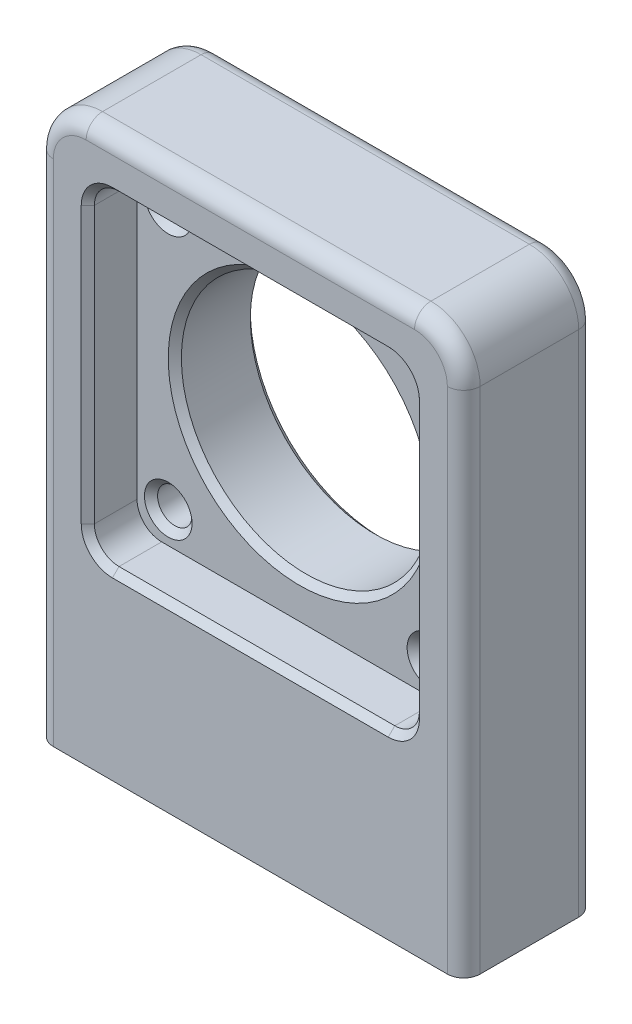
from build123d import *

# Parameters (mm, degrees)
SKETCH1_W           = 26
SKETCH1_H           = 34
BOSS_EXTRUDE1_DEPTH = 8
CUT_EXTRUDE1_REACH  = 24.847
SKETCH2_R           = 7.6
SKETCH2_R_2         = 1.05
SKETCH5_R           = 2.3
CUT_EXTRUDE7_DEPTH  = 4.5
SKETCH6_W           = 19.8
SKETCH6_H           = 19.8
CUT_EXTRUDE8_DEPTH  = 3
SKETCH7_R           = 1.9
CUT_EXTRUDE9_DEPTH  = 3
FILLET1_R           = 3
CHAMFER3_SIZE       = 0.4
FILLET2_R           = 1.5
CHAMFER7_SIZE       = 1
CHAMFER9_SIZE       = 0.4
CHAMFER10_SIZE      = 0.4
FILLET4_R           = 1


with BuildPart() as part:
    # Sketch1 → Boss-Extrude1 (new body)
    with BuildSketch(Plane.XY):
        Rectangle(SKETCH1_W, SKETCH1_H)
    extrude(amount=BOSS_EXTRUDE1_DEPTH)

    # Sketch2 → Cut-Extrude1 (cut, up to next)
    with BuildSketch(Plane.XY.offset(8), mode=Mode.PRIVATE) as cut_extrude1_sk1:
        with Locations((0, 4)):
            Circle(SKETCH2_R)
    cut_extrude1_tool1 = extrude(cut_extrude1_sk1.sketch, amount=-CUT_EXTRUDE1_REACH, mode=Mode.PRIVATE) & part.part
    # Sketch2 → Cut-Extrude1 (cut, up to next)
    with BuildSketch(Plane.XY.offset(8), mode=Mode.PRIVATE) as cut_extrude1_sk2:
        with Locations((-8, 12)):
            Circle(SKETCH2_R_2)
    cut_extrude1_tool2 = extrude(cut_extrude1_sk2.sketch, amount=-CUT_EXTRUDE1_REACH, mode=Mode.PRIVATE) & part.part
    # Sketch2 → Cut-Extrude1 (cut, up to next)
    with BuildSketch(Plane.XY.offset(8), mode=Mode.PRIVATE) as cut_extrude1_sk3:
        with Locations((8, 12)):
            Circle(SKETCH2_R_2)
    cut_extrude1_tool3 = extrude(cut_extrude1_sk3.sketch, amount=-CUT_EXTRUDE1_REACH, mode=Mode.PRIVATE) & part.part
    # Sketch2 → Cut-Extrude1 (cut, up to next)
    with BuildSketch(Plane.XY.offset(8), mode=Mode.PRIVATE) as cut_extrude1_sk4:
        with Locations((8, -4)):
            Circle(SKETCH2_R_2)
    cut_extrude1_tool4 = extrude(cut_extrude1_sk4.sketch, amount=-CUT_EXTRUDE1_REACH, mode=Mode.PRIVATE) & part.part
    # Sketch2 → Cut-Extrude1 (cut, up to next)
    with BuildSketch(Plane.XY.offset(8), mode=Mode.PRIVATE) as cut_extrude1_sk5:
        with Locations((-8, -4)):
            Circle(SKETCH2_R_2)
    cut_extrude1_tool5 = extrude(cut_extrude1_sk5.sketch, amount=-CUT_EXTRUDE1_REACH, mode=Mode.PRIVATE) & part.part
    add(cut_extrude1_tool1.solids().sort_by_distance((0, 4, 8))[0], mode=Mode.SUBTRACT)
    add(cut_extrude1_tool2.solids().sort_by_distance((-8, 12, 8))[0], mode=Mode.SUBTRACT)
    add(cut_extrude1_tool3.solids().sort_by_distance((8, 12, 8))[0], mode=Mode.SUBTRACT)
    add(cut_extrude1_tool4.solids().sort_by_distance((8, -4, 8))[0], mode=Mode.SUBTRACT)
    add(cut_extrude1_tool5.solids().sort_by_distance((-8, -4, 8))[0], mode=Mode.SUBTRACT)

    # Sketch5 → Cut-Extrude7 (cut)
    with BuildSketch(Plane.XZ.offset(17)):
        with Locations(Location((6, 4, 0), (0, 0, 270))):
            Circle(SKETCH5_R)
        with Locations(Location((-6, 4, 0), (0, 0, 90))):
            Circle(SKETCH5_R)
    extrude(amount=-CUT_EXTRUDE7_DEPTH, mode=Mode.SUBTRACT)

    # Sketch6 → Cut-Extrude8 (cut)
    with BuildSketch(Plane.XY.offset(8)):
        with Locations((0, 4)):
            Rectangle(SKETCH6_W, SKETCH6_H)
    extrude(amount=-CUT_EXTRUDE8_DEPTH, mode=Mode.SUBTRACT)

    # Sketch7 → Cut-Extrude9 (cut)
    with BuildSketch(Plane(origin=(0, 0, 0), x_dir=(-1, 0, 0), z_dir=(0, 0, -1))):
        with Locations((-8, 12)):
            Circle(SKETCH7_R)
        with Locations((8, 12)):
            Circle(SKETCH7_R)
        with Locations((-8, -4)):
            Circle(SKETCH7_R)
        with Locations((8, -4)):
            Circle(SKETCH7_R)
    extrude(amount=-CUT_EXTRUDE9_DEPTH, mode=Mode.SUBTRACT)

    # Fillet1
    fillet1_edges = [part.edges().sort_by_distance(p)[0] for p in [
        (-13, 17, 4),
        (13, 17, 4),
    ]]
    fillet(fillet1_edges, radius=FILLET1_R)

    # Chamfer3
    chamfer3_edges = [part.edges().sort_by_distance(p)[0] for p in [
        (6, -12.5, 6.3),
        (6, -17, 6.3),
        (-6, -12.5, 1.7),
        (-6, -17, 1.7),
    ]]
    chamfer(chamfer3_edges, length=CHAMFER3_SIZE)

    # Fillet2
    fillet2_edges = [part.edges().sort_by_distance(p)[0] for p in [
        (9.9, 13.9, 6.5),
        (9.9, -5.9, 6.5),
        (-9.9, -5.9, 6.5),
        (-9.9, 13.9, 6.5),
    ]]
    fillet(fillet2_edges, radius=FILLET2_R)

    # Chamfer7
    # the kernel refuses this chamfer: 1 mm, written as the material it adds along each edge
    with BuildSketch(Plane(origin=(-8, 12, 3), x_dir=(-1, 0, 0), z_dir=(0, -1, 0))) as chamfer7_piece_1_section:
        Polygon((1.9, CHAMFER7_SIZE), (1.9 - CHAMFER7_SIZE, 0), (1.9, 0), align=None)
    chamfer7_piece_1 = revolve(axis=Axis((-8, 12, 3), (0, 0, -1)), mode=Mode.PRIVATE)
    chamfer7_piece_1 = chamfer7_piece_1 - Plane(origin=(-8, 12, 2.4231984), x_dir=(1, 0, 0), z_dir=(0, 0, 1)) * Cylinder(1.05, 8, mode=Mode.PRIVATE)
    add(chamfer7_piece_1)
    with BuildSketch(Plane(origin=(8, 12, 3), x_dir=(-1, 0, 0), z_dir=(0, -1, 0))) as chamfer7_piece_2_section:
        Polygon((1.9, CHAMFER7_SIZE), (1.9 - CHAMFER7_SIZE, 0), (1.9, 0), align=None)
    chamfer7_piece_2 = revolve(axis=Axis((8, 12, 3), (0, 0, -1)), mode=Mode.PRIVATE)
    chamfer7_piece_2 = chamfer7_piece_2 - Plane(origin=(8, 12, 2.4231984), x_dir=(1, 0, 0), z_dir=(0, 0, 1)) * Cylinder(1.05, 8, mode=Mode.PRIVATE)
    add(chamfer7_piece_2)
    with BuildSketch(Plane(origin=(8, -4, 3), x_dir=(-1, 0, 0), z_dir=(0, -1, 0))) as chamfer7_piece_3_section:
        Polygon((1.9, CHAMFER7_SIZE), (1.9 - CHAMFER7_SIZE, 0), (1.9, 0), align=None)
    chamfer7_piece_3 = revolve(axis=Axis((8, -4, 3), (0, 0, -1)), mode=Mode.PRIVATE)
    chamfer7_piece_3 = chamfer7_piece_3 - Plane(origin=(8, -4, 2.4231984), x_dir=(1, 0, 0), z_dir=(0, 0, 1)) * Cylinder(1.05, 8, mode=Mode.PRIVATE)
    add(chamfer7_piece_3)
    with BuildSketch(Plane(origin=(-8, -4, 3), x_dir=(-1, 0, 0), z_dir=(0, -1, 0))) as chamfer7_piece_4_section:
        Polygon((1.9, CHAMFER7_SIZE), (1.9 - CHAMFER7_SIZE, 0), (1.9, 0), align=None)
    chamfer7_piece_4 = revolve(axis=Axis((-8, -4, 3), (0, 0, -1)), mode=Mode.PRIVATE)
    chamfer7_piece_4 = chamfer7_piece_4 - Plane(origin=(-8, -4, 2.4231984), x_dir=(1, 0, 0), z_dir=(0, 0, 1)) * Cylinder(1.05, 8, mode=Mode.PRIVATE)
    add(chamfer7_piece_4)

    # Chamfer9
    chamfer9_edges = [part.edges().sort_by_distance(p)[0] for p in [
        (0, -5.9, 8),
        (-9.9, 4, 8),
        (9.9, 4, 8),
        (0, 13.9, 8),
        (-9.460660172, -5.460660172, 8),
        (9.460660172, -5.460660172, 8),
        (9.460660172, 13.460660172, 8),
        (-9.460660172, 13.460660172, 8),
        (-7.6, 4, 0),
        (-7.6, 4, 5),
        (-6.1, 12, 0),
        (9.9, -4, 0),
        (-6.1, -4, 0),
        (9.9, 12, 0),
    ]]
    chamfer(chamfer9_edges, length=CHAMFER9_SIZE)

    # Chamfer10
    chamfer10_edges = [part.edges().sort_by_distance(p)[0] for p in [
        (-9.05, 12, 5),
        (6.95, 12, 5),
        (6.95, -4, 5),
        (-9.05, -4, 5),
    ]]
    chamfer(chamfer10_edges, length=CHAMFER10_SIZE)

    # Fillet4
    fillet4_edges = [part.edges().sort_by_distance(p)[0] for p in [
        (13, -1.5, 8),
        (13, -1.5, 0),
        (0, 17, 0),
        (0, 17, 8),
        (-13, -1.5, 0),
        (-12.121320344, 16.121320344, 0),
        (12.121320344, 16.121320344, 0),
        (-13, -1.5, 8),
        (-12.121320344, 16.121320344, 8),
        (12.121320344, 16.121320344, 8),
    ]]
    fillet(fillet4_edges, radius=FILLET4_R)


solid = part.part
